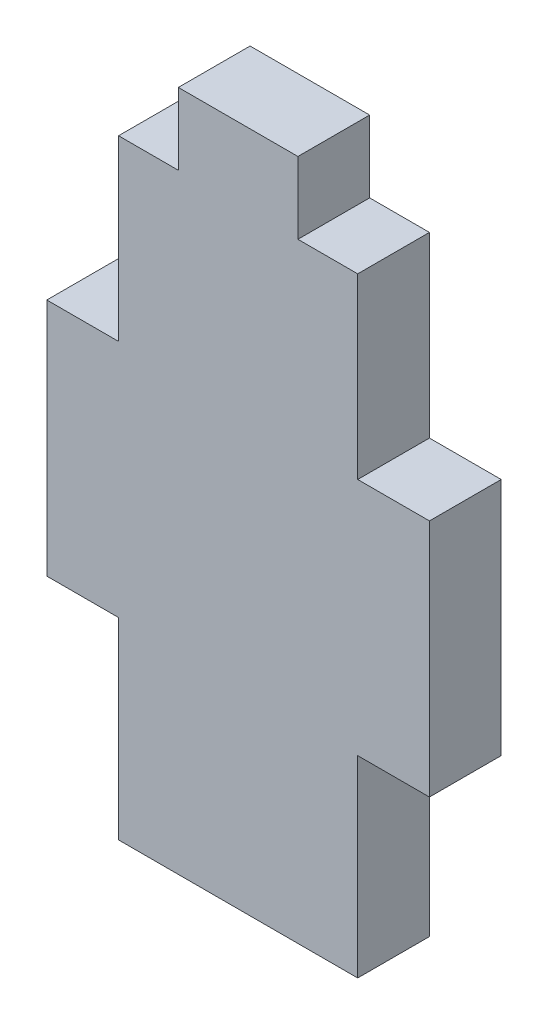
from build123d import *

# Parameters (mm, degrees)
SKETCH1_W             = 16
SKETCH1_H             = 28.5
BOSS_EXTRUDE1_DEPTH   = 3
CAVITY1_START         = 23.498167492
CAVITY1_OUTLINE_W     = 10.447458445
CAVITY1_OUTLINE_H     = 3
CAVITY1_OUTLINE_W_2   = 8.052541555
CAVITY1_DEPTH         = 3
CAVITY1_START_2       = 36.498167492
CAVITY1_2_OUTLINE_W   = 10.447458445
CAVITY1_2_OUTLINE_H   = 3
CAVITY1_2_OUTLINE_W_2 = 8.052541555
CAVITY1_2_DEPTH       = 3
CAVITY1_START_3       = 26.498167492
CAVITY1_3_OUTLINE_W   = 3
CAVITY1_3_OUTLINE_H   = 3
CAVITY1_3_DEPTH       = 2.5
CAVITY1_START_4       = 33.998167492
CAVITY1_4_OUTLINE_W   = 3
CAVITY1_4_OUTLINE_H   = 3
CAVITY1_4_DEPTH       = 2.5


# Read off the part's stored shape, not the designer's step: Cavity1
with BuildPart() as part:
    # Sketch1 → Boss-Extrude1 (new body)
    with BuildSketch(Plane.XY):
        with Locations((31.498167492, 24.589698152)):
            Rectangle(SKETCH1_W, SKETCH1_H)
    extrude(amount=BOSS_EXTRUDE1_DEPTH)

    # Cavity1 outline → Cavity1 (cut)
    with BuildSketch(Plane.YZ.offset(CAVITY1_START)):
        with Locations((33.615968929, 1.5)):
            Rectangle(CAVITY1_OUTLINE_W, CAVITY1_OUTLINE_H)
        with Locations((14.36596893, 1.5)):
            Rectangle(CAVITY1_OUTLINE_W_2, CAVITY1_OUTLINE_H)
    extrude(amount=CAVITY1_DEPTH, mode=Mode.SUBTRACT)

    # Cavity1 2 outline → Cavity1 2 (cut)
    with BuildSketch(Plane.YZ.offset(CAVITY1_START_2)):
        with Locations((33.615968929, 1.5)):
            Rectangle(CAVITY1_2_OUTLINE_W, CAVITY1_2_OUTLINE_H)
        with Locations((14.36596893, 1.5)):
            Rectangle(CAVITY1_2_OUTLINE_W_2, CAVITY1_2_OUTLINE_H)
    extrude(amount=CAVITY1_2_DEPTH, mode=Mode.SUBTRACT)

    # Cavity1 3 outline → Cavity1 3 (cut)
    with BuildSketch(Plane.YZ.offset(CAVITY1_START_3)):
        with Locations((37.339698152, 1.5)):
            Rectangle(CAVITY1_3_OUTLINE_W, CAVITY1_3_OUTLINE_H)
    extrude(amount=CAVITY1_3_DEPTH, mode=Mode.SUBTRACT)

    # Cavity1 4 outline → Cavity1 4 (cut)
    with BuildSketch(Plane.YZ.offset(CAVITY1_START_4)):
        with Locations((37.339698152, 1.5)):
            Rectangle(CAVITY1_4_OUTLINE_W, CAVITY1_4_OUTLINE_H)
    extrude(amount=CAVITY1_4_DEPTH, mode=Mode.SUBTRACT)


solid = part.part
